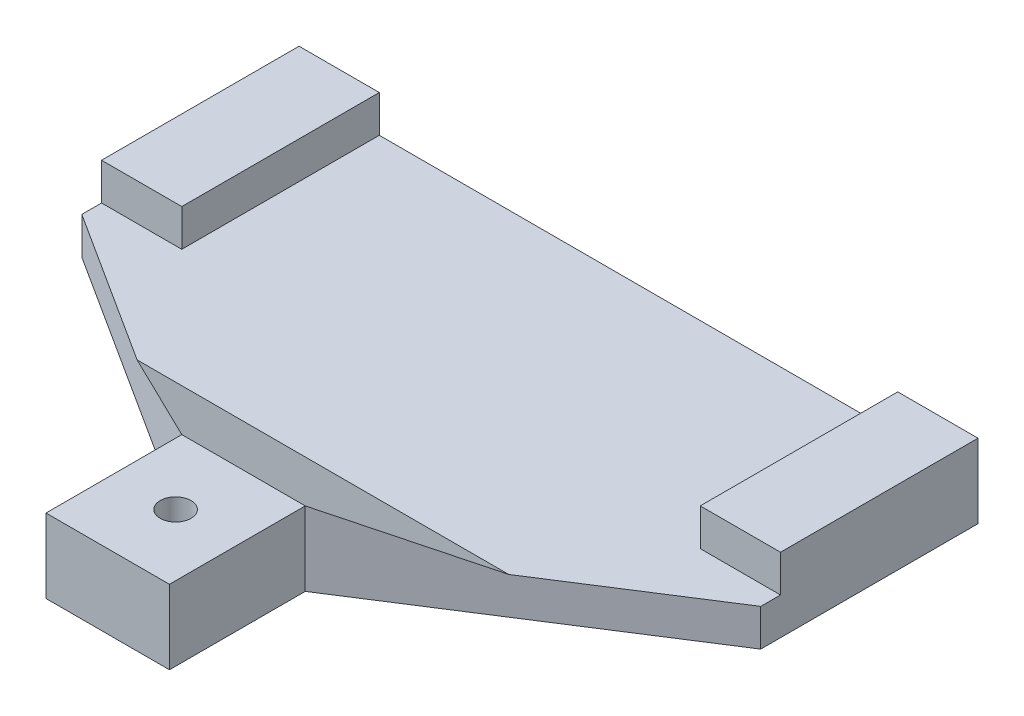
from build123d import *

# Parameters (mm, degrees)
ESQUISSE1_W             = 60
ESQUISSE1_H             = 6
BOSS_EXTRU_1_DEPTH      = 60
ESQUISSE2_R             = 1.25
ENL_V_MAT_EXTRU_1_DEPTH = 15
ESQUISSE3_R             = 1.25
ENL_V_MAT_EXTRU_2_DEPTH = 15
ESQUISSE4_W             = 10
ESQUISSE4_H             = 11
ENL_V_MAT_EXTRU_3_DEPTH = 3
ENL_V_MAT_EXTRU_4_DEPTH = 52
CHANFREIN1_SIZE2        = 6.433520762
CHANFREIN1_SIZE         = 3
ESQUISSE6_W             = 2.5
ESQUISSE6_H             = 6
ENL_V_MAT_EXTRU_5_DEPTH = 40


with BuildPart() as part:
    # Esquisse1 → Boss.-Extru.1 (new body)
    with BuildSketch(Plane.XY):
        with Locations((30, 3)):
            Rectangle(ESQUISSE1_W, ESQUISSE1_H)
    extrude(amount=BOSS_EXTRU_1_DEPTH)

    # Esquisse2 → Enlèv. mat.-Extru.1 (cut)
    with BuildSketch(Plane(origin=(0, 0, 0), x_dir=(-1, 0, 0), z_dir=(0, 0, -1))):
        with Locations((-54, 3)):
            Circle(ESQUISSE2_R)
        with Locations((-5.75, 3)):
            Circle(ESQUISSE2_R)
    extrude(amount=-ENL_V_MAT_EXTRU_1_DEPTH, mode=Mode.SUBTRACT)

    # Esquisse3 → Enlèv. mat.-Extru.2 (cut)
    with BuildSketch(Plane(origin=(0, 6, 0), x_dir=(1, 0, 0), z_dir=(0, 1, 0))):
        with Locations(Location((30, -37.5, 0), (0, 0, 270))):
            Circle(ESQUISSE3_R)
    extrude(amount=-ENL_V_MAT_EXTRU_2_DEPTH, mode=Mode.SUBTRACT)

    # Esquisse4 → Enlèv. mat.-Extru.3 (cut)
    with BuildSketch(Plane(origin=(0, 6, 0), x_dir=(1, 0, 0), z_dir=(0, 1, 0))):
        Polygon((0, -16), (9, -16), (9, 0), (51, 0), (51, -16), (60, -16), (60, -60), (0, -60), align=None)
        with Locations((30, -37.5)):
            Rectangle(ESQUISSE4_W, ESQUISSE4_H, mode=Mode.SUBTRACT)
    extrude(amount=-ENL_V_MAT_EXTRU_3_DEPTH, mode=Mode.SUBTRACT)

    # Esquisse5 → Enlèv. mat.-Extru.4 (cut)
    with BuildSketch(Plane(origin=(0, 3, 0), x_dir=(1, 0, 0), z_dir=(0, 1, 0))):
        Polygon((60, -16), (35, -32), (35, -43), (25, -43), (25, -32), (0, -16), (-21.594855386, -85.475485762), (75.414479662, -69.930764824), align=None)
    extrude(amount=-ENL_V_MAT_EXTRU_4_DEPTH, mode=Mode.SUBTRACT)

    # Chanfrein1
    chanfrein1_edges = [part.edges().sort_by_distance(p)[0] for p in [
        (30, 3, 32),
    ]]
    chanfrein1_side = [part.faces().sort_by_distance(p)[0] for p in [
        (30, 3.06, 32),
    ]]
    chamfer(chanfrein1_edges, length=CHANFREIN1_SIZE - 0.0001, length2=CHANFREIN1_SIZE2 - 0.0001, reference=chanfrein1_side[0])  # a hair under: the kernel refuses the full size

    # Esquisse6 → Enlèv. mat.-Extru.5 (cut)
    with BuildSketch(Plane(origin=(0, 0, 0), x_dir=(-1, 0, 0), z_dir=(0, 0, -1))):
        with Locations((-58.75, 3)):
            Rectangle(ESQUISSE6_W, ESQUISSE6_H)
        with Locations((-1.25, 3)):
            Rectangle(ESQUISSE6_W, ESQUISSE6_H)
    extrude(amount=-ENL_V_MAT_EXTRU_5_DEPTH, mode=Mode.SUBTRACT)


solid = part.part
